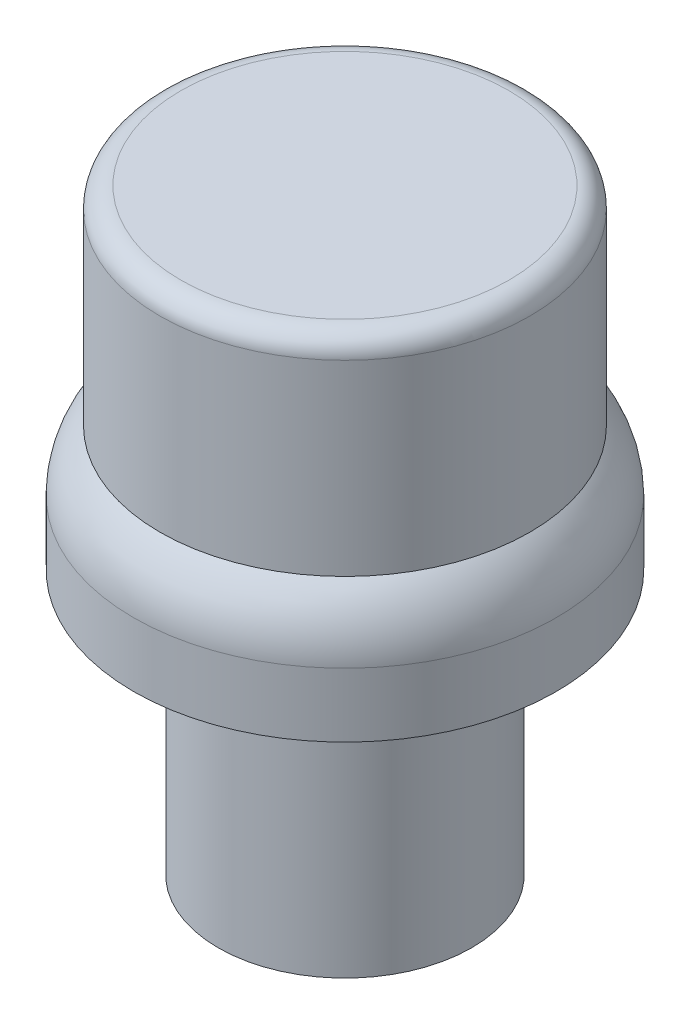
from build123d import *

# Parameters (mm, degrees)
SKETCH1_R           = 5.08
BOSS_EXTRUDE1_DEPTH = 3
SKETCH2_R           = 4.445
BOSS_EXTRUDE2_DEPTH = 5
FILLET2_R           = 2
FILLET3_R           = 0.5
SKETCH3_R           = 3.048
BOSS_EXTRUDE3_DEPTH = 6.35
SKETCH4_W           = 1.587384834
SKETCH4_H           = 1.489913834
CUT_EXTRUDE1_DEPTH  = 1.27


with BuildPart() as part:
    # Sketch1 → Boss-Extrude1 (new body)
    with BuildSketch(Plane(origin=(0, 0, 0), x_dir=(1, 0, 0), z_dir=(0, 1, 0))):
        with Locations(Location((0, 0, 0), (0, 0, 270))):
            Circle(SKETCH1_R)
    extrude(amount=BOSS_EXTRUDE1_DEPTH)

    # Sketch2 → Boss-Extrude2 (add)
    with BuildSketch(Plane(origin=(0, 3, 0), x_dir=(1, 0, 0), z_dir=(0, 1, 0))):
        with Locations(Location((0, 0, 0), (0, 0, 270))):
            Circle(SKETCH2_R)
    extrude(amount=BOSS_EXTRUDE2_DEPTH)

    # Fillet2
    # the kernel refuses this fillet: 2 mm, written as the material it takes off along each edge
    with BuildSketch(Plane(origin=(0, 3, 0), x_dir=(0, 0, 1), z_dir=(-1, 0, 0))) as fillet2_piece_1:
        with BuildLine():
            CenterArc((3.08, -1.461771186), FILLET2_R, 0, 46.960687898)
            Line((4.445, 0), (4.4723, 0.029235424))
            ThreePointArc((4.4723, 0.029235424), (4.7625, 0.04), (5.08, 0.04))
            Line((5.08, 0.04), (5.12, 0))
            Line((5.12, 0), (5.12, -1.461771186))
            Line((5.12, -1.461771186), (5.08, -1.461771186))
        make_face()
    revolve(axis=Axis((0, 3, 0), (0, 1, 0)), mode=Mode.SUBTRACT)

    # Fillet3
    fillet3_edges = [part.edges().sort_by_distance(p)[0] for p in [
        (0, 8, -4.445),
    ]]
    fillet(fillet3_edges, radius=FILLET3_R)

    # Sketch3 → Boss-Extrude3 (add)
    with BuildSketch(Plane.XZ):
        with Locations(Location((0, 0, 0), (0, 0, 270))):
            Circle(SKETCH3_R)
    extrude(amount=BOSS_EXTRUDE3_DEPTH)

    # Sketch4 → Cut-Extrude1 (cut)
    with BuildSketch(Plane.XZ.offset(6.35)):
        Rectangle(SKETCH4_W, SKETCH4_H)
    extrude(amount=-CUT_EXTRUDE1_DEPTH, mode=Mode.SUBTRACT)


solid = part.part
